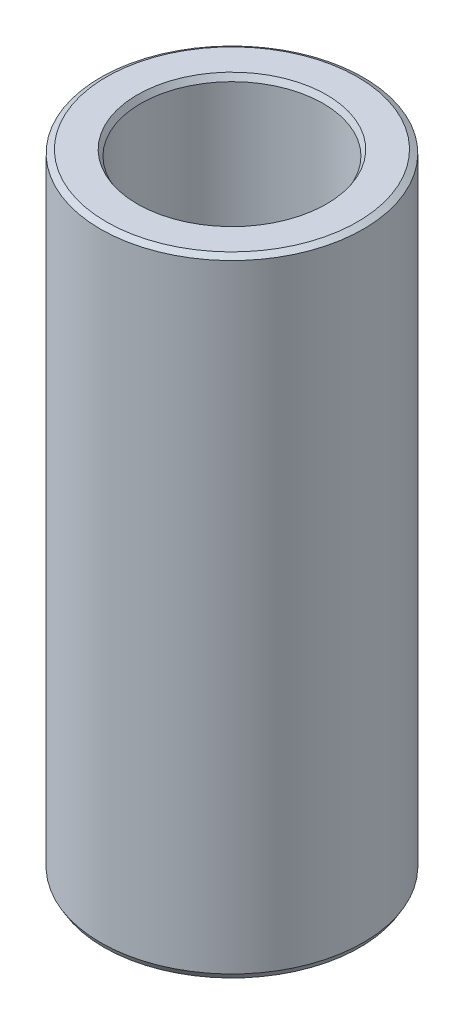
from build123d import *
from OCP.BRepFilletAPI import BRepFilletAPI_MakeChamfer

# Parameters (mm, degrees)
SKETCH1_R           = 47.5
BOSS_EXTRUDE1_DEPTH = 226.66443349
SKETCH2_R           = 32.980583589
CUT_EXTRUDE1_DEPTH  = 237.40910602
CHAMFER1_SIZE       = 1.220366428
CHAMFER1_SIZE2      = 2.113736657


with BuildPart() as part:
    # Sketch1 → Boss-Extrude1 (new body)
    with BuildSketch(Plane(origin=(0, 0, 0), x_dir=(1, 0, 0), z_dir=(0, 1, 0))):
        Circle(SKETCH1_R)
    extrude(amount=BOSS_EXTRUDE1_DEPTH)

    # Sketch2 → Cut-Extrude1 (cut, through all)
    with BuildSketch(Plane(origin=(0, 0, 0), x_dir=(1, 0, 0), z_dir=(0, 1, 0))):
        Circle(SKETCH2_R)
    extrude(amount=CUT_EXTRUDE1_DEPTH, mode=Mode.SUBTRACT)

    # Chamfer1: one chamfer whose edges measure the first distance from different faces: ONE call of the kernel's chamfer builder (chamfer() names one face for all edges)
    chamfer1_edges_1 = [part.edges().sort_by_distance(p)[0] for p in [
        (-32.980583589, 226.66443349, 0),
    ]]
    chamfer1_side_1 = [part.faces().sort_by_distance(p)[0] for p in [
        (-46.156497116, 226.66443349, 0),
    ]]
    chamfer1_edges_2 = [part.edges().sort_by_distance(p)[0] for p in [
        (-32.980583589, 0, 0),
    ]]
    chamfer1_side_2 = [part.faces().sort_by_distance(p)[0] for p in [
        (-32.980583589, 113.332216745, 0),
    ]]
    chamfer1_edges_3 = [part.edges().sort_by_distance(p)[0] for p in [
        (-47.5, 0, 0),
    ]]
    chamfer1_side_3 = [part.faces().sort_by_distance(p)[0] for p in [
        (-46.156497116, 0, 0),
    ]]
    chamfer1_edges_4 = [part.edges().sort_by_distance(p)[0] for p in [
        (-47.5, 226.66443349, 0),
    ]]
    chamfer1_side_4 = [part.faces().sort_by_distance(p)[0] for p in [
        (-47.5, 113.332216745, 0),
    ]]
    chamfer1 = BRepFilletAPI_MakeChamfer(part.part.solid().wrapped)
    for e in chamfer1_edges_1:
        chamfer1.Add(CHAMFER1_SIZE, CHAMFER1_SIZE2, e.wrapped, chamfer1_side_1[0].wrapped)  # the first distance lies on this face
    for e in chamfer1_edges_2:
        chamfer1.Add(CHAMFER1_SIZE, CHAMFER1_SIZE2, e.wrapped, chamfer1_side_2[0].wrapped)  # the first distance lies on this face
    for e in chamfer1_edges_3:
        chamfer1.Add(CHAMFER1_SIZE, CHAMFER1_SIZE2, e.wrapped, chamfer1_side_3[0].wrapped)  # the first distance lies on this face
    for e in chamfer1_edges_4:
        chamfer1.Add(CHAMFER1_SIZE, CHAMFER1_SIZE2, e.wrapped, chamfer1_side_4[0].wrapped)  # the first distance lies on this face
    add(Compound.cast(chamfer1.Shape()), mode=Mode.REPLACE)


solid = part.part
